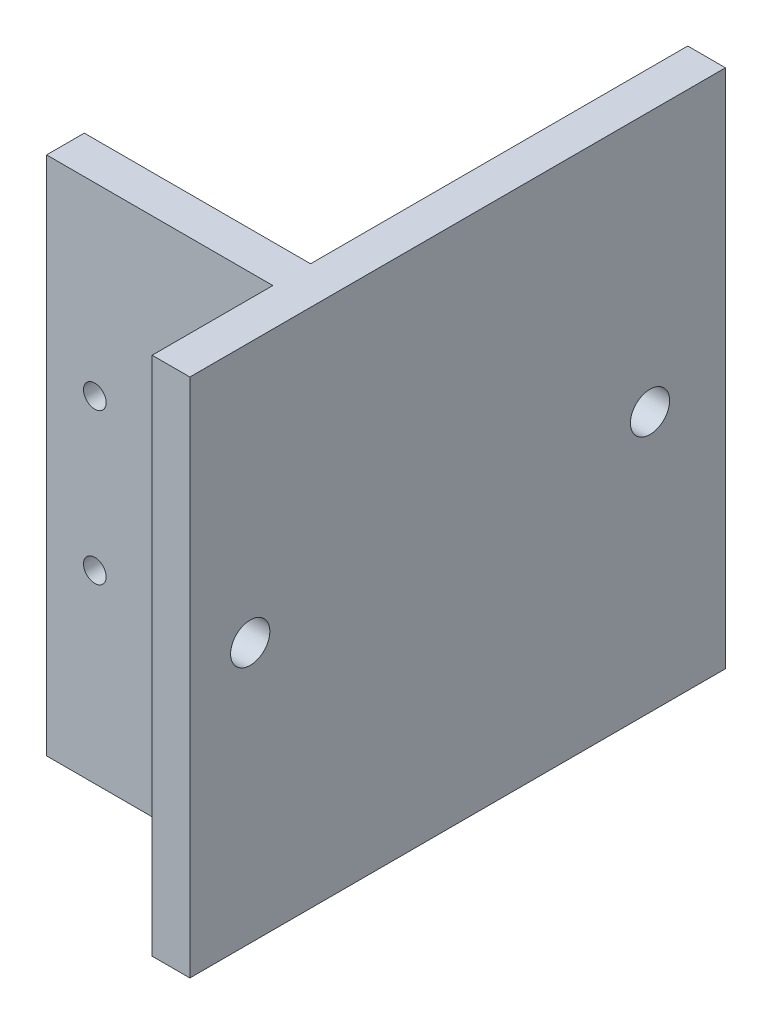
from build123d import *

# Parameters (mm, degrees)
EXTRUDE_1_DEPTH     = 69
HOLE_WIZARD_1_D     = 3
SKETCH_5_R          = 2.6
CUT_EXTRUDE_1_DEPTH = 10
SKETCH_6_R          = 2.6
CUT_EXTRUDE_2_DEPTH = 10


with BuildPart() as part:
    # 草图1 → 凸台-拉伸1 (new body)
    with BuildSketch(Plane(origin=(0, 0, 0), x_dir=(1, 0, 0), z_dir=(0, 1, 0))):
        Polygon((30, 0), (30, 50), (35, 50), (35, -21), (30, -21), (30, -5), (0, -5), (0, 0), align=None)
    extrude(amount=EXTRUDE_1_DEPTH)

    # 孔1 (through all)
    with Locations(Plane.XY.offset(5)):
        with Locations((26.4, 44.5), (26.4, 24.5), (6.4, 44.5), (6.4, 24.5)):
            Hole(HOLE_WIZARD_1_D / 2)

    # 草图5 → 切除-拉伸1 (cut)
    with BuildSketch(Plane.ZY.offset(-30)):
        with Locations((13, 34.5)):
            Circle(SKETCH_5_R)
    extrude(amount=-CUT_EXTRUDE_1_DEPTH, mode=Mode.SUBTRACT)

    # 草图6 → 切除-拉伸2 (cut)
    with BuildSketch(Plane.ZY.offset(-30)):
        with Locations((-40, 34.5)):
            Circle(SKETCH_6_R)
    extrude(amount=-CUT_EXTRUDE_2_DEPTH, mode=Mode.SUBTRACT)


solid = part.part
